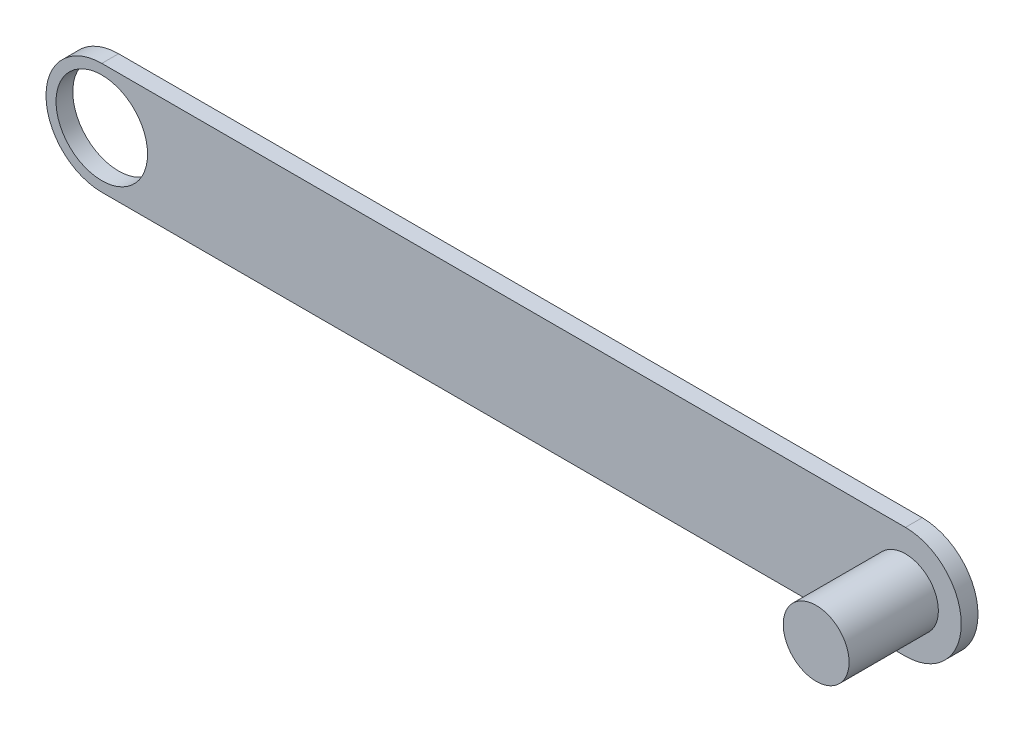
from build123d import *

# Parameters (mm, degrees)
BOSS_EXTRUDE4_DEPTH = 1.5
SKETCH4_R           = 4.1
CUT_EXTRUDE1_DEPTH  = 78.176745202
SKETCH5_R           = 2.95
BOSS_EXTRUDE5_DEPTH = 8


with BuildPart() as part:
    # Sketch1 → Boss-Extrude4 (new body)
    with BuildSketch(Plane.XY):
        with BuildLine():
            Line((0, 5), (72, 5))
            ThreePointArc((72, 5), (77, 0), (72, -5))
            Line((72, -5), (0, -5))
            ThreePointArc((0, -5), (-5, 0), (0, 5))
        make_face()
    extrude(amount=BOSS_EXTRUDE4_DEPTH)

    # Sketch4 → Cut-Extrude1 (cut, through all)
    with BuildSketch(Plane.XY.offset(1.5)):
        Circle(SKETCH4_R)
    extrude(amount=-CUT_EXTRUDE1_DEPTH, mode=Mode.SUBTRACT)

    # Sketch5 → Boss-Extrude5 (add)
    with BuildSketch(Plane.XY.offset(1.5)):
        with Locations((72, 0)):
            Circle(SKETCH5_R)
    extrude(amount=BOSS_EXTRUDE5_DEPTH)


solid = part.part
